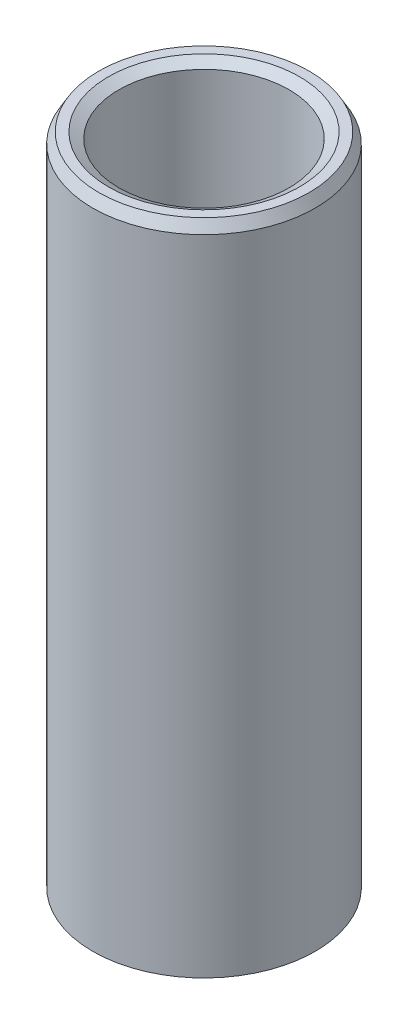
from build123d import *
from OCP.BRepFilletAPI import BRepFilletAPI_MakeChamfer

# Parameters (mm, degrees)
SKETCH1_R           = 37.5
BOSS_EXTRUDE1_DEPTH = 222.511324481
SKETCH2_R           = 28.674126739
CUT_EXTRUDE1_DEPTH  = 229.743938766
CHAMFER1_SIZE       = 3.52757517
CHAMFER1_SIZE2      = 2.036646474


with BuildPart() as part:
    # Sketch1 → Boss-Extrude1 (new body)
    with BuildSketch(Plane(origin=(0, 0, 0), x_dir=(1, 0, 0), z_dir=(0, 1, 0))):
        Circle(SKETCH1_R)
    extrude(amount=BOSS_EXTRUDE1_DEPTH)

    # Sketch2 → Cut-Extrude1 (cut, through all)
    with BuildSketch(Plane(origin=(0, 0, 0), x_dir=(1, 0, 0), z_dir=(0, 1, 0))):
        Circle(SKETCH2_R)
    extrude(amount=CUT_EXTRUDE1_DEPTH, mode=Mode.SUBTRACT)

    # Chamfer1: one chamfer whose edges measure the first distance from different faces: ONE call of the kernel's chamfer builder (chamfer() names one face for all edges)
    chamfer1_edges_1 = [part.edges().sort_by_distance(p)[0] for p in [
        (-28.674126739, 222.511324481, 0),
    ]]
    chamfer1_side_1 = [part.faces().sort_by_distance(p)[0] for p in [
        (-36.439339828, 222.511324481, 0),
    ]]
    chamfer1_edges_2 = [part.edges().sort_by_distance(p)[0] for p in [
        (-28.674126739, 0, 0),
    ]]
    chamfer1_side_2 = [part.faces().sort_by_distance(p)[0] for p in [
        (-28.674126739, 111.255662241, 0),
    ]]
    chamfer1_edges_3 = [part.edges().sort_by_distance(p)[0] for p in [
        (-37.5, 0, 0),
    ]]
    chamfer1_side_3 = [part.faces().sort_by_distance(p)[0] for p in [
        (-36.439339828, 0, 0),
    ]]
    chamfer1_edges_4 = [part.edges().sort_by_distance(p)[0] for p in [
        (-37.5, 222.511324481, 0),
    ]]
    chamfer1_side_4 = [part.faces().sort_by_distance(p)[0] for p in [
        (-37.5, 111.255662241, 0),
    ]]
    chamfer1 = BRepFilletAPI_MakeChamfer(part.part.solid().wrapped)
    for e in chamfer1_edges_1:
        chamfer1.Add(CHAMFER1_SIZE, CHAMFER1_SIZE2, e.wrapped, chamfer1_side_1[0].wrapped)  # the first distance lies on this face
    for e in chamfer1_edges_2:
        chamfer1.Add(CHAMFER1_SIZE, CHAMFER1_SIZE2, e.wrapped, chamfer1_side_2[0].wrapped)  # the first distance lies on this face
    for e in chamfer1_edges_3:
        chamfer1.Add(CHAMFER1_SIZE, CHAMFER1_SIZE2, e.wrapped, chamfer1_side_3[0].wrapped)  # the first distance lies on this face
    for e in chamfer1_edges_4:
        chamfer1.Add(CHAMFER1_SIZE, CHAMFER1_SIZE2, e.wrapped, chamfer1_side_4[0].wrapped)  # the first distance lies on this face
    add(Compound.cast(chamfer1.Shape()), mode=Mode.REPLACE)


solid = part.part
